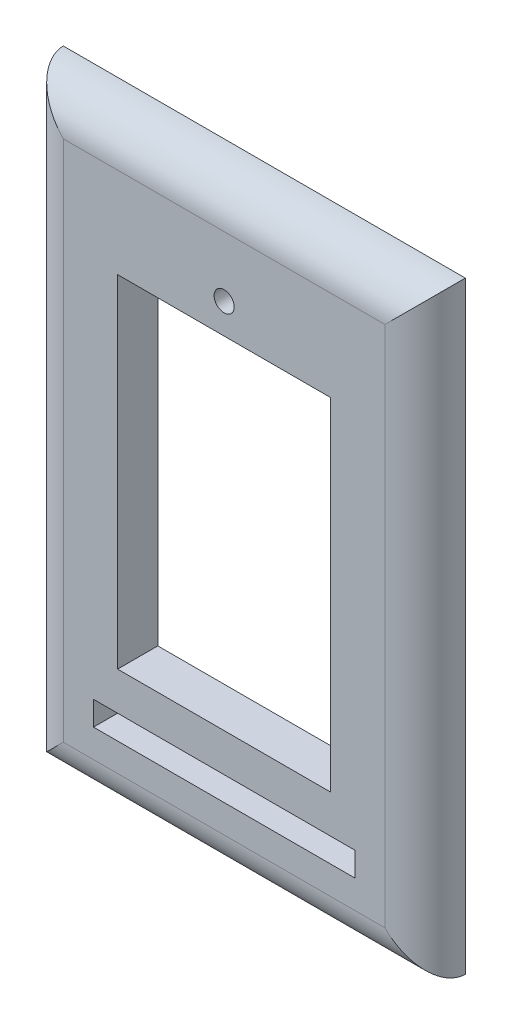
from build123d import *

# Parameters (mm, degrees)
SKETCH2_W           = 100
SKETCH2_H           = 150
BOSS_EXTRUDE1_DEPTH = 10
FILLET1_R           = 10
SKETCH3_R           = 2.5
CUT_EXTRUDE1_DEPTH  = 10
SKETCH4_W           = 53
SKETCH4_H           = 85
CUT_EXTRUDE2_DEPTH  = 10
SKETCH5_W           = 65
SKETCH5_H           = 6
CUT_EXTRUDE3_DEPTH  = 10


with BuildPart() as part:
    # Sketch2 → Boss-Extrude1 (new body)
    with BuildSketch(Plane.XY):
        Rectangle(SKETCH2_W, SKETCH2_H)
    extrude(amount=BOSS_EXTRUDE1_DEPTH)

    # Fillet1
    fillet1_edges = [part.edges().sort_by_distance(p)[0] for p in [
        (50, 0, 10),
        (0, 75, 10),
        (-50, 0, 10),
        (0, -75, 10),
    ]]
    fillet(fillet1_edges, radius=FILLET1_R - 0.0001)  # a hair under: the kernel refuses the full size

    # Sketch3 → Cut-Extrude1 (cut)
    with BuildSketch(Plane.XY.offset(10)):
        with Locations((0, 50)):
            Circle(SKETCH3_R)
    extrude(amount=-CUT_EXTRUDE1_DEPTH, mode=Mode.SUBTRACT)

    # Sketch4 → Cut-Extrude2 (cut)
    with BuildSketch(Plane.XY.offset(10)):
        Rectangle(SKETCH4_W, SKETCH4_H)
    extrude(amount=-CUT_EXTRUDE2_DEPTH, mode=Mode.SUBTRACT)

    # Sketch5 → Cut-Extrude3 (cut)
    with BuildSketch(Plane.XY.offset(10)):
        with Locations((0, -55)):
            Rectangle(SKETCH5_W, SKETCH5_H)
    extrude(amount=-CUT_EXTRUDE3_DEPTH, mode=Mode.SUBTRACT)


solid = part.part
